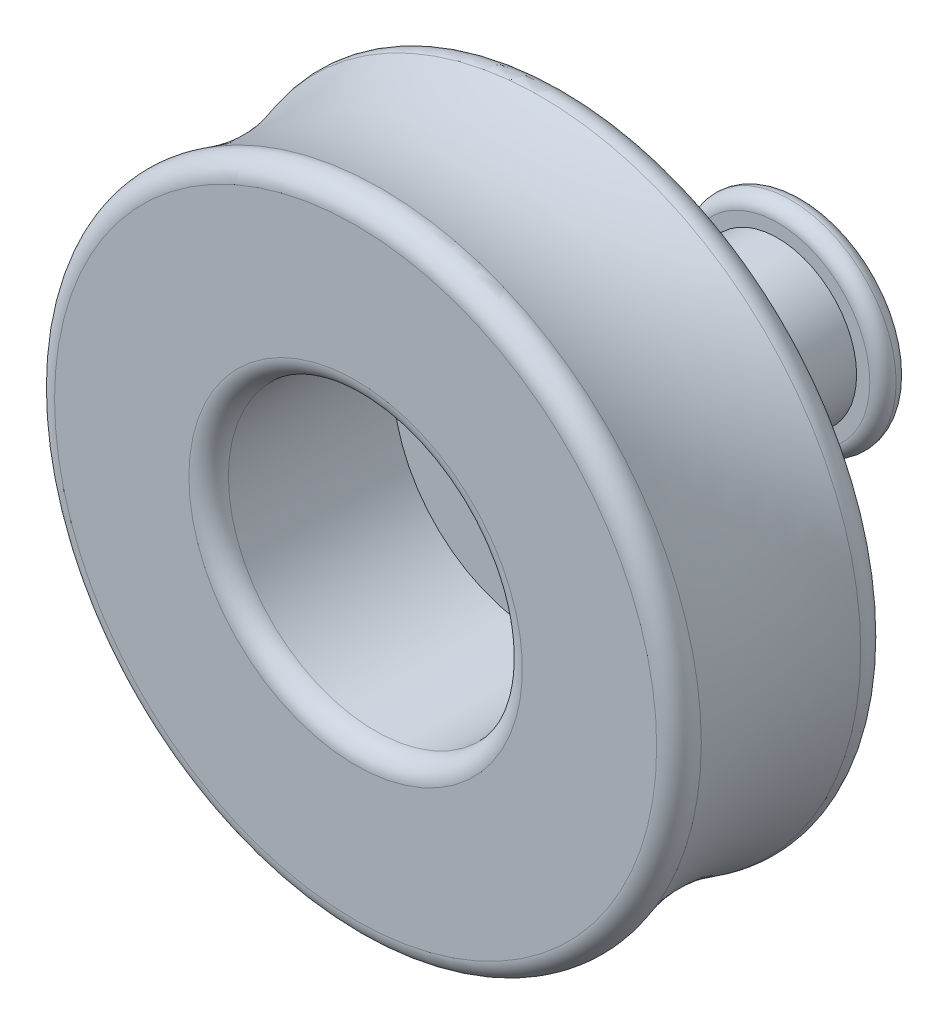
from build123d import *

# Parameters (mm, degrees)
SKETCH2_W          = 6
SKETCH2_H          = 7
SKETCH3_R          = 11.15
CUT_EXTRUDE1_DEPTH = 14
SKETCH8_R          = 4.25
CUT_EXTRUDE3_DEPTH = 50.307707308
FILLET1_R          = 1.5
FILLET2_R          = 1.5
FILLET3_R          = 1
FILLET4_R          = 1.5


with BuildPart() as part:
    # Sketch2 → Revolve1 (revolve)
    with BuildSketch(Plane(origin=(0, 0, 0), x_dir=(1, 0, 0), z_dir=(0, 1, 0)), mode=Mode.PRIVATE) as revolve1_sk:
        with BuildLine():
            Line((-12.5, 8), (12.5, 8))
            Line((12.5, 8), (12.5, -8))
            Line((12.5, -8), (-12.5, -8))
            ThreePointArc((-12.5, -8), (-10.83030278, 0), (-12.5, 8))
        make_face()
        with Locations((9.5, 11.5)):
            Rectangle(SKETCH2_W, SKETCH2_H)
        Polygon((6.5, 15), (12.5, 15), (12.5, 17), (6.5, 17), (4.5, 17), (4.5, 15), align=None)
        with Locations((9.5, 20.5)):
            Rectangle(SKETCH2_W, SKETCH2_H)
        Polygon((6.5, 24), (12.5, 24), (12.5, 26), (4.5, 26), (4.5, 24), align=None)
    revolve(revolve1_sk.sketch.rotate(Axis((12.5, 0, 8), (0, 0, -1)), 180), axis=Axis((12.5, 0, 8), (0, 0, -1)))

    # Sketch3 → Cut-Extrude1 (cut)
    with BuildSketch(Plane.XY.offset(8)):
        with Locations((12.5, 0)):
            Circle(SKETCH3_R)
    extrude(amount=-CUT_EXTRUDE1_DEPTH, mode=Mode.SUBTRACT)

    # Sketch8 → Cut-Extrude3 (cut, through all)
    with BuildSketch(Plane.XY.offset(-6)):
        with Locations((12.5, 0)):
            Circle(SKETCH8_R)
    extrude(amount=-CUT_EXTRUDE3_DEPTH, mode=Mode.SUBTRACT)

    # Fillet1
    fillet1_edges = [part.edges().sort_by_distance(p)[0] for p in [
        (8.25, 0, -6),
    ]]
    fillet(fillet1_edges, radius=FILLET1_R)

    # Fillet2
    fillet2_edges = [part.edges().sort_by_distance(p)[0] for p in [
        (-12.5, 0, 8),
        (-12.5, 0, -8),
        (1.35, 0, 8),
    ]]
    fillet(fillet2_edges, radius=FILLET2_R)

    # Fillet3
    fillet3_edges = [part.edges().sort_by_distance(p)[0] for p in [
        (4.5, 0, -15),
        (4.5, 0, -17),
        (4.5, 0, -24),
        (4.5, 0, -26),
    ]]
    fillet(fillet3_edges, radius=FILLET3_R - 0.0001)  # a hair under: the kernel refuses the full size

    # Fillet4
    fillet4_edges = [part.edges().sort_by_distance(p)[0] for p in [
        (8.25, 0, -26),
    ]]
    fillet(fillet4_edges, radius=FILLET4_R)


solid = part.part
